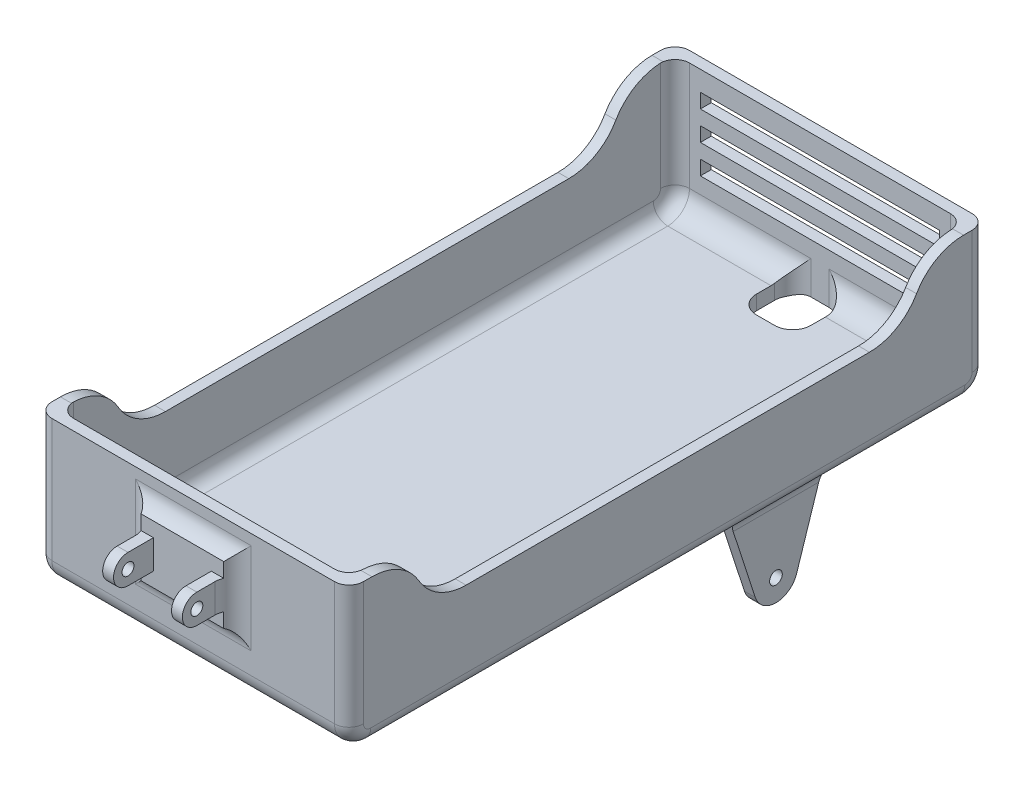
from build123d import *

# Parameters (mm, degrees)
SKETCH_1_W          = 22
SKETCH_1_H          = 16
EXTRUDE_1_DEPTH     = 3
SKETCH_2_R          = 1.65
EXTRUDE_2_DEPTH     = 3
SKETCH_3_W          = 176
SKETCH_3_H          = 40
EXTRUDE_3_DEPTH     = 43
SKETCH_4_W          = 80
SKETCH_4_H          = 170
CUT_EXTRUDE_1_DEPTH = 36
EXTRUDE_START       = -5
SKETCH_5_R          = 1.75
EXTRUDE_4_DEPTH     = 3
FILLET_1_R          = 5
CUT_EXTRUDE_2_DEPTH = 203.544439568
SKETCH_7_W          = 15
SKETCH_7_H          = 15
CUT_EXTRUDE_3_DEPTH = 185.718705063
FILLET_2_R          = 5
FILLET_3_R          = 6
FILLET_4_R          = 6
FILLET_5_R          = 6
FILLET_6_R          = 6
FILLET_7_R          = 4
FILLET_8_R          = 4
FILLET_START        = -44
FILLET_10_DEPTH     = 88
FILLET_START_2      = -43
FILLET_10_2_DEPTH   = 3
FILLET_START_3      = 40
FILLET_10_3_DEPTH   = 3
FILLET_11_R         = 5
FILLET_12_R         = 5
FILLET_13_R         = 5
CUT_EXTRUDE_5_REACH = 203.498
SKETCH_9_W          = 66
SKETCH_9_H          = 4


with BuildPart() as part:
    # 草图1 → 凸台-拉伸1 (new body)
    with BuildSketch(Plane.XY):
        Rectangle(SKETCH_1_W, SKETCH_1_H)
    extrude(amount=EXTRUDE_1_DEPTH)

    # 草图2 → 凸台-拉伸2 (add)
    with BuildSketch(Plane(origin=(11, 0, 0), x_dir=(0, 0, -1), z_dir=(1, 0, 0))):
        with BuildLine():
            Line((-3, -4), (-10, -4))
            ThreePointArc((-10, -4), (-14, 0), (-10, 4))
            Line((-10, 4), (-3, 4))
            Line((-3, 4), (-3, -4))
        make_face()
        with Locations((-10, 0)):
            Circle(SKETCH_2_R, mode=Mode.SUBTRACT)
    extrude_2 = extrude(amount=-EXTRUDE_2_DEPTH)

    # 镜向1: 凸台-拉伸2 across plane
    add(extrude_2.mirror(Plane(origin=(0, 0, 0), x_dir=(0, 0, 1), z_dir=(1, 0, 0))))

    # 草图3 → 凸台-拉伸3 (add, symmetric)
    with BuildSketch(Plane(origin=(0, 0, 0), x_dir=(0, 0, -1), z_dir=(1, 0, 0))):
        with Locations((88, -4.5)):
            Rectangle(SKETCH_3_W, SKETCH_3_H)
    extrude(amount=EXTRUDE_3_DEPTH, both=True)

    # 草图4 → 切除-拉伸1 (cut)
    with BuildSketch(Plane(origin=(0, 15.5, 0), x_dir=(1, 0, 0), z_dir=(0, 1, 0))):
        with Locations((0, 88)):
            Rectangle(SKETCH_4_W, SKETCH_4_H)
    extrude(amount=-CUT_EXTRUDE_1_DEPTH, mode=Mode.SUBTRACT)

    # 草图5 → 凸台-拉伸4 (add)
    with BuildSketch(Plane(origin=(43, 0, 0), x_dir=(0, 0, -1), z_dir=(1, 0, 0)).offset(EXTRUDE_START)):
        with BuildLine():
            Line((109.735826067, -24.5), (117.161573936, -47.354101966))
            ThreePointArc((117.161573936, -47.354101966), (122.867913034, -51.5), (128.574252131, -47.354101966))
            Line((128.574252131, -47.354101966), (136, -24.5))
            Line((136, -24.5), (109.735826067, -24.5))
        make_face()
        with Locations((122.867913034, -45.5)):
            Circle(SKETCH_5_R, mode=Mode.SUBTRACT)
    extrude_4 = extrude(amount=-EXTRUDE_4_DEPTH)

    # 镜向2: 凸台-拉伸4 across plane
    add(extrude_4.mirror(Plane(origin=(0, 0, 0), x_dir=(0, 0, 1), z_dir=(1, 0, 0))))

    # 圆角1
    fillet_1_edges = [part.edges().sort_by_distance(p)[0] for p in [
        (35, -24.5, -122.867913034),
        (-35, -24.5, -122.867913034),
    ]]
    fillet(fillet_1_edges, radius=FILLET_1_R)

    # 草图6 → 切除-拉伸2 (cut, through all)
    with BuildSketch(Plane(origin=(43, 0, 0), x_dir=(0, 0, -1), z_dir=(1, 0, 0))):
        Polygon((15, 15.5), (23.660254038, 0.5), (152.339745962, 0.5), (161, 15.5), align=None)
    extrude(amount=-CUT_EXTRUDE_2_DEPTH, mode=Mode.SUBTRACT)

    # 草图7 → 切除-拉伸3 (cut, through all)
    with BuildSketch(Plane(origin=(0, -20.5, 0), x_dir=(1, 0, 0), z_dir=(0, 1, 0))):
        with Locations((0, 165.5)):
            Rectangle(SKETCH_7_W, SKETCH_7_H)
    extrude(amount=-CUT_EXTRUDE_3_DEPTH, mode=Mode.SUBTRACT)

    # 圆角2
    fillet_2_edges = [part.edges().sort_by_distance(p)[0] for p in [
        (7.5, -22.5, -173),
        (7.5, -22.5, -158),
        (-7.5, -22.5, -158),
        (-7.5, -22.5, -173),
    ]]
    fillet(fillet_2_edges, radius=FILLET_2_R)

    # 圆角3
    fillet_3_edges = [part.edges().sort_by_distance(p)[0] for p in [
        (0, -24.5, 0),
    ]]
    fillet(fillet_3_edges, radius=FILLET_3_R)

    # 圆角4
    fillet_4_edges = [part.edges().sort_by_distance(p)[0] for p in [
        (0, -20.5, -3),
    ]]
    fillet(fillet_4_edges, radius=FILLET_4_R)

    # 圆角5
    fillet_5_edges = [part.edges().sort_by_distance(p)[0] for p in [
        (21.25, -20.5, -173),
        (-21.25, -20.5, -173),
    ]]
    fillet(fillet_5_edges, radius=FILLET_5_R)

    # 圆角6
    # the kernel refuses this fillet: 6 mm, written as the material it takes off along each edge
    with BuildSketch(Plane(origin=(58, -24.5, -176), x_dir=(0, 0, 1), z_dir=(-1, 0, 0))) as fillet_6_piece_1:
        with BuildLine():
            CenterArc((FILLET_6_R, FILLET_6_R), FILLET_6_R, 180, 90)
            Line((0, FILLET_6_R), (0, 0))
            Line((0, 0), (FILLET_6_R, 0))
        make_face()
    extrude(amount=116, mode=Mode.SUBTRACT)

    # 圆角7
    fillet_7_edges = [part.edges().sort_by_distance(p)[0] for p in [
        (-43, -24.5, -88),
        (43, -24.5, -88),
        (-43, -22.742640687, -1.757359313),
        (43, -22.742640687, -1.757359313),
        (-43, -1.5, -176),
        (43, -1.5, -176),
        (-43, -22.742640687, -174.242640687),
        (43, -22.742640687, -174.242640687),
        (-43, -1.5, 0),
        (43, -1.5, 0),
    ]]
    fillet(fillet_7_edges, radius=FILLET_7_R)

    # 圆角8
    fillet_8_edges = [part.edges().sort_by_distance(p)[0] for p in [
        (40, -20.5, -88),
        (40, 0.5, -3),
        (40, -18.742640687, -4.757359313),
        (-40, 0.5, -3),
        (-40, -18.742640687, -4.757359313),
        (-40, -20.5, -88),
        (40, 0.5, -173),
        (-40, 0.5, -173),
        (40, -18.742640687, -171.242640687),
        (-40, -18.742640687, -171.242640687),
    ]]
    fillet(fillet_8_edges, radius=FILLET_8_R)

    # 圆角10: read off the stored shape, not the designer's step
    # 圆角10 outline → 圆角10 (cut)
    with BuildSketch(Plane.YZ.offset(FILLET_START)):
        with BuildLine():
            Line((15.5, -161), (8, -156.669872981))
            ThreePointArc((8, -156.669872981), (13.490381057, -162.160254038), (15.5, -169.660254038))
            Line((15.5, -169.660254038), (15.5, -161))
        make_face()
        with BuildLine():
            ThreePointArc((15.5, -6.339745962), (13.490381057, -13.839745962), (8, -19.330127019))
            Line((8, -19.330127019), (15.5, -15))
            Line((15.5, -15), (15.5, -6.339745962))
        make_face()
    extrude(amount=FILLET_10_DEPTH, mode=Mode.SUBTRACT)

    # Fillet 10 2 outline → Fillet 10 2 (add)
    with BuildSketch(Plane.YZ.offset(FILLET_START_2)):
        with BuildLine():
            Line((0.5, -23.660254038), (0.5, -32.320508076))
            ThreePointArc((0.5, -32.320508076), (2.509618943, -24.820508076), (8, -19.330127019))
            Line((8, -19.330127019), (0.5, -23.660254038))
        make_face()
        with BuildLine():
            ThreePointArc((8, -156.669872981), (2.509618943, -151.179491924), (0.5, -143.679491924))
            Line((0.5, -143.679491924), (0.5, -152.339745962))
            Line((0.5, -152.339745962), (8, -156.669872981))
        make_face()
    extrude(amount=FILLET_10_2_DEPTH)

    # Fillet 10 3 outline → Fillet 10 3 (add)
    with BuildSketch(Plane.YZ.offset(FILLET_START_3)):
        with BuildLine():
            Line((0.5, -23.660254038), (0.5, -32.320508076))
            ThreePointArc((0.5, -32.320508076), (2.509618943, -24.820508076), (8, -19.330127019))
            Line((8, -19.330127019), (0.5, -23.660254038))
        make_face()
        with BuildLine():
            ThreePointArc((8, -156.669872981), (2.509618943, -151.179491924), (0.5, -143.679491924))
            Line((0.5, -143.679491924), (0.5, -152.339745962))
            Line((0.5, -152.339745962), (8, -156.669872981))
        make_face()
    extrude(amount=FILLET_10_3_DEPTH)

    # 圆角11
    # the kernel refuses this fillet: 5 mm, written as the material it adds along each edge
    with BuildSketch(Plane(origin=(-11, -8, 0), x_dir=(0, -1, 0), z_dir=(1, 0, 0)), Plane(origin=(11, 8, 0), x_dir=(0, 1, 0), z_dir=(-1, 0, 0))) as fillet_11_piece_1:
        with BuildLine():
            CenterArc((4.582575695, -5), FILLET_11_R, 90, 66.421821522)
            Line((0, -3), (0, 0))
            Line((0, 0), (4.582575695, 0))
        make_face()
    extrude(amount=22)
    with BuildSketch(Plane(origin=(-11, 8, 0), x_dir=(-1, 0, 0), z_dir=(0, -1, 0))) as fillet_11_piece_2_section:
        with BuildLine():
            CenterArc((FILLET_11_R, -FILLET_11_R), FILLET_11_R, 90, 90)
            Line((0, -FILLET_11_R), (0, 0))
            Line((0, 0), (FILLET_11_R, 0))
        make_face()
    fillet_11_piece_2 = extrude(amount=16, mode=Mode.PRIVATE)
    fillet_11_piece_2 = split(fillet_11_piece_2, bisect_by=Plane(origin=(-11, 8, 3), z_dir=(0, 0, -1)), keep=Keep.TOP, mode=Mode.PRIVATE)
    add(fillet_11_piece_2)
    with BuildSketch(Plane(origin=(-11, 20.5, 0), x_dir=(-1, 0, 0), z_dir=(0, -1, 0))) as fillet_11_piece_3_section:
        with BuildLine():
            CenterArc((FILLET_11_R, -FILLET_11_R), FILLET_11_R, 90, 90)
            Line((0, -FILLET_11_R), (0, 0))
            Line((0, 0), (FILLET_11_R, 0))
        make_face()
    fillet_11_piece_3 = extrude(amount=41, mode=Mode.PRIVATE)
    fillet_11_piece_3 = split(fillet_11_piece_3, bisect_by=Plane(origin=(-11, 4, 0), z_dir=(0, -1, 0)), keep=Keep.TOP, mode=Mode.PRIVATE)
    fillet_11_piece_3 = split(fillet_11_piece_3, bisect_by=Plane(origin=(-11, -4, 0), z_dir=(0, 1, 0)), keep=Keep.TOP, mode=Mode.PRIVATE)
    add(fillet_11_piece_3)
    with BuildSketch(Plane(origin=(11, -8, 0), x_dir=(1, 0, 0), z_dir=(0, 1, 0))) as fillet_11_piece_4_section:
        with BuildLine():
            CenterArc((FILLET_11_R, -FILLET_11_R), FILLET_11_R, 90, 90)
            Line((0, -FILLET_11_R), (0, 0))
            Line((0, 0), (FILLET_11_R, 0))
        make_face()
    fillet_11_piece_4 = extrude(amount=16, mode=Mode.PRIVATE)
    fillet_11_piece_4 = split(fillet_11_piece_4, bisect_by=Plane(origin=(11, -8, 3), z_dir=(0, 0, -1)), keep=Keep.TOP, mode=Mode.PRIVATE)
    add(fillet_11_piece_4)
    with BuildSketch(Plane(origin=(11, -20.5, 0), x_dir=(1, 0, 0), z_dir=(0, 1, 0))) as fillet_11_piece_5_section:
        with BuildLine():
            CenterArc((FILLET_11_R, -FILLET_11_R), FILLET_11_R, 90, 90)
            Line((0, -FILLET_11_R), (0, 0))
            Line((0, 0), (FILLET_11_R, 0))
        make_face()
    fillet_11_piece_5 = extrude(amount=41, mode=Mode.PRIVATE)
    fillet_11_piece_5 = split(fillet_11_piece_5, bisect_by=Plane(origin=(11, -4, 0), z_dir=(0, 1, 0)), keep=Keep.TOP, mode=Mode.PRIVATE)
    fillet_11_piece_5 = split(fillet_11_piece_5, bisect_by=Plane(origin=(11, 4, 0), z_dir=(0, -1, 0)), keep=Keep.TOP, mode=Mode.PRIVATE)
    add(fillet_11_piece_5)
    with BuildSketch(Plane(origin=(-11, 8, 0), x_dir=(-1, 0, 0), z_dir=(0, -1, 0))) as fillet_11_piece_6a_section:
        with BuildLine():
            CenterArc((FILLET_11_R, -FILLET_11_R), FILLET_11_R, 90, 90)
            Line((0, -FILLET_11_R), (0, 0))
            Line((0, 0), (FILLET_11_R, 0))
        make_face()
    fillet_11_piece_6a = extrude(amount=28.5, mode=Mode.PRIVATE)
    fillet_11_piece_6a = split(fillet_11_piece_6a, bisect_by=Plane(origin=(-11, -8, 0), z_dir=(0, -1, 0)), keep=Keep.TOP, mode=Mode.PRIVATE)
    fillet_11_piece_6a = split(fillet_11_piece_6a, bisect_by=Plane(origin=(-11, 8, 3), z_dir=(0, 0, -1)), keep=Keep.TOP, mode=Mode.PRIVATE)
    with BuildSketch(Plane(origin=(-22.456439237, -8, 0), x_dir=(0, -1, 0), z_dir=(1, 0, 0))) as fillet_11_piece_6b_section:
        with BuildLine():
            CenterArc((4.582575695, -5), FILLET_11_R, 90, 66.421821522)
            Line((0, -3), (0, 0))
            Line((0, 0), (4.582575695, 0))
        make_face()
    fillet_11_piece_6b = extrude(amount=33.456439237, mode=Mode.PRIVATE)
    fillet_11_piece_6b = split(fillet_11_piece_6b, bisect_by=Plane(origin=(-11, -8, 0), z_dir=(-1, 0, 0)), keep=Keep.TOP, mode=Mode.PRIVATE)
    fillet_11_piece_6 = fillet_11_piece_6a & fillet_11_piece_6b
    add(fillet_11_piece_6)
    with BuildSketch(Plane(origin=(11, -20.5, 0), x_dir=(1, 0, 0), z_dir=(0, 1, 0))) as fillet_11_piece_7a_section:
        with BuildLine():
            CenterArc((FILLET_11_R, -FILLET_11_R), FILLET_11_R, 90, 90)
            Line((0, -FILLET_11_R), (0, 0))
            Line((0, 0), (FILLET_11_R, 0))
        make_face()
    fillet_11_piece_7a = extrude(amount=28.5, mode=Mode.PRIVATE)
    fillet_11_piece_7a = split(fillet_11_piece_7a, bisect_by=Plane(origin=(11, -8, 0), z_dir=(0, -1, 0)), keep=Keep.TOP, mode=Mode.PRIVATE)
    fillet_11_piece_7a = split(fillet_11_piece_7a, bisect_by=Plane(origin=(11, -20.5, 3), z_dir=(0, 0, -1)), keep=Keep.TOP, mode=Mode.PRIVATE)
    with BuildSketch(Plane(origin=(-11, -8, 0), x_dir=(0, -1, 0), z_dir=(1, 0, 0))) as fillet_11_piece_7b_section:
        with BuildLine():
            CenterArc((4.582575695, -5), FILLET_11_R, 90, 66.421821522)
            Line((0, -3), (0, 0))
            Line((0, 0), (4.582575695, 0))
        make_face()
    fillet_11_piece_7b = extrude(amount=33.456439237, mode=Mode.PRIVATE)
    fillet_11_piece_7b = split(fillet_11_piece_7b, bisect_by=Plane(origin=(11, -8, 0), z_dir=(1, 0, 0)), keep=Keep.TOP, mode=Mode.PRIVATE)
    fillet_11_piece_7 = fillet_11_piece_7a & fillet_11_piece_7b
    add(fillet_11_piece_7)
    with BuildSketch(Plane(origin=(-11, 20.5, 0), x_dir=(-1, 0, 0), z_dir=(0, -1, 0))) as fillet_11_piece_8a_section:
        with BuildLine():
            CenterArc((FILLET_11_R, -FILLET_11_R), FILLET_11_R, 90, 90)
            Line((0, -FILLET_11_R), (0, 0))
            Line((0, 0), (FILLET_11_R, 0))
        make_face()
    fillet_11_piece_8a = extrude(amount=28.5, mode=Mode.PRIVATE)
    fillet_11_piece_8a = split(fillet_11_piece_8a, bisect_by=Plane(origin=(-11, 15.5, 0), z_dir=(0, -1, 0)), keep=Keep.TOP, mode=Mode.PRIVATE)
    fillet_11_piece_8a = split(fillet_11_piece_8a, bisect_by=Plane(origin=(-11, 8, 0), z_dir=(0, 1, 0)), keep=Keep.TOP, mode=Mode.PRIVATE)
    fillet_11_piece_8a = split(fillet_11_piece_8a, bisect_by=Plane(origin=(-11, 20.5, 3), z_dir=(0, 0, -1)), keep=Keep.TOP, mode=Mode.PRIVATE)
    with BuildSketch(Plane(origin=(11, 8, 0), x_dir=(0, 1, 0), z_dir=(-1, 0, 0))) as fillet_11_piece_8b_section:
        with BuildLine():
            CenterArc((4.582575695, -5), FILLET_11_R, 90, 66.421821522)
            Line((0, -3), (0, 0))
            Line((0, 0), (4.582575695, 0))
        make_face()
    fillet_11_piece_8b = extrude(amount=33.456439237, mode=Mode.PRIVATE)
    fillet_11_piece_8b = split(fillet_11_piece_8b, bisect_by=Plane(origin=(-11, 8, 0), z_dir=(-1, 0, 0)), keep=Keep.TOP, mode=Mode.PRIVATE)
    fillet_11_piece_8 = fillet_11_piece_8a & fillet_11_piece_8b
    add(fillet_11_piece_8)
    with BuildSketch(Plane(origin=(22.456439237, 8, 0), x_dir=(0, 1, 0), z_dir=(-1, 0, 0))) as fillet_11_piece_9a_section:
        with BuildLine():
            CenterArc((4.582575695, -5), FILLET_11_R, 90, 66.421821522)
            Line((0, -3), (0, 0))
            Line((0, 0), (4.582575695, 0))
        make_face()
    fillet_11_piece_9a = extrude(amount=33.456439237, mode=Mode.PRIVATE)
    fillet_11_piece_9a = split(fillet_11_piece_9a, bisect_by=Plane(origin=(11, 8, 0), z_dir=(1, 0, 0)), keep=Keep.TOP, mode=Mode.PRIVATE)
    with BuildSketch(Plane(origin=(11, -8, 0), x_dir=(1, 0, 0), z_dir=(0, 1, 0))) as fillet_11_piece_9b_section:
        with BuildLine():
            CenterArc((FILLET_11_R, -FILLET_11_R), FILLET_11_R, 90, 90)
            Line((0, -FILLET_11_R), (0, 0))
            Line((0, 0), (FILLET_11_R, 0))
        make_face()
    fillet_11_piece_9b = extrude(amount=28.5, mode=Mode.PRIVATE)
    fillet_11_piece_9b = split(fillet_11_piece_9b, bisect_by=Plane(origin=(11, 15.5, 0), z_dir=(0, -1, 0)), keep=Keep.TOP, mode=Mode.PRIVATE)
    fillet_11_piece_9b = split(fillet_11_piece_9b, bisect_by=Plane(origin=(11, 8, 0), z_dir=(0, 1, 0)), keep=Keep.TOP, mode=Mode.PRIVATE)
    fillet_11_piece_9b = split(fillet_11_piece_9b, bisect_by=Plane(origin=(11, -8, 3), z_dir=(0, 0, -1)), keep=Keep.TOP, mode=Mode.PRIVATE)
    fillet_11_piece_9 = fillet_11_piece_9a & fillet_11_piece_9b
    add(fillet_11_piece_9)

    # 圆角12
    # the kernel refuses this fillet: 5 mm, written as the material it adds along each edge
    with BuildSketch(Plane(origin=(-38, -24.5, -146.155644371), x_dir=(-0.9889307289952856, 0.14837794057356693, 0), z_dir=(0, 0, 1))) as fillet_12_piece_1_section:
        with BuildLine():
            CenterArc((4.341904206, 4.759181219), FILLET_12_R, 188.532937529, 63.612200039)
            Line((-0.602749439, 4.017291516), (-1.097214803, 3.943102546))
            Line((-1.097214803, 3.943102546), (-0.494465364, -0.07418897))
            Line((-0.494465364, -0.07418897), (0.07418897, -0.494465364))
            ThreePointArc((0.07418897, -0.494465364), (1.063119699, -0.346087424), (2.655566492, -0.475918122))
            Line((2.655566492, -0.475918122), (2.80886992, 0))
        make_face()
    fillet_12_piece_1 = extrude(amount=46.575462674, mode=Mode.PRIVATE)
    fillet_12_piece_1 = split(fillet_12_piece_1, bisect_by=Plane(origin=(-38, -21.515331006, -136.969777743), z_dir=(0, 0.3090169943749409, 0.9510565162951558)), keep=Keep.TOP, mode=Mode.PRIVATE)
    fillet_12_piece_1 = split(fillet_12_piece_1, bisect_by=Plane(origin=(-38, -35.203516045, -113.213609249), z_dir=(0, 0.3090169943749446, -0.9510565162951545)), keep=Keep.TOP, mode=Mode.PRIVATE)
    add(fillet_12_piece_1)

    # 圆角13
    # the kernel refuses this fillet: 5 mm, written as the material it adds along each edge
    with BuildSketch(Plane(origin=(38, -24.5, -146.155644371), x_dir=(0.9889307289952856, 0.14837794057356693, 0), z_dir=(0, 0, 1))) as fillet_13_piece_1_section:
        with BuildLine():
            CenterArc((4.341904206, -4.759181219), FILLET_13_R, 107.854862432, 63.612200039)
            Line((-0.602749439, -4.017291516), (-1.097214803, -3.943102546))
            Line((-1.097214803, -3.943102546), (-0.494465364, 0.07418897))
            Line((-0.494465364, 0.07418897), (0.07418897, 0.494465364))
            ThreePointArc((0.07418897, 0.494465364), (1.063119699, 0.346087424), (2.655566492, 0.475918122))
            Line((2.655566492, 0.475918122), (2.80886992, 0))
        make_face()
    fillet_13_piece_1 = extrude(amount=46.575462674, mode=Mode.PRIVATE)
    fillet_13_piece_1 = split(fillet_13_piece_1, bisect_by=Plane(origin=(38, -21.515331006, -136.969777743), z_dir=(0, 0.3090169943749409, 0.9510565162951558)), keep=Keep.TOP, mode=Mode.PRIVATE)
    fillet_13_piece_1 = split(fillet_13_piece_1, bisect_by=Plane(origin=(38, -35.203516045, -113.213609249), z_dir=(0, 0.3090169943749446, -0.9510565162951545)), keep=Keep.TOP, mode=Mode.PRIVATE)
    add(fillet_13_piece_1)

    # 草图9 → 切除-拉伸5 (cut, up to next)
    with BuildSketch(Plane(origin=(0, 0, -176), x_dir=(-1, 0, 0), z_dir=(0, 0, -1)), mode=Mode.PRIVATE) as cut_extrude_5_sk1:
        with Locations((0, 8)):
            Rectangle(SKETCH_9_W, SKETCH_9_H)
    cut_extrude_5_tool1 = extrude(cut_extrude_5_sk1.sketch, amount=-CUT_EXTRUDE_5_REACH, mode=Mode.PRIVATE) & part.part
    # 草图9 → 切除-拉伸5 (cut, up to next)
    with BuildSketch(Plane(origin=(0, 0, -176), x_dir=(-1, 0, 0), z_dir=(0, 0, -1)), mode=Mode.PRIVATE) as cut_extrude_5_sk2:
        Rectangle(SKETCH_9_W, SKETCH_9_H)
    cut_extrude_5_tool2 = extrude(cut_extrude_5_sk2.sketch, amount=-CUT_EXTRUDE_5_REACH, mode=Mode.PRIVATE) & part.part
    # 草图9 → 切除-拉伸5 (cut, up to next)
    with BuildSketch(Plane(origin=(0, 0, -176), x_dir=(-1, 0, 0), z_dir=(0, 0, -1)), mode=Mode.PRIVATE) as cut_extrude_5_sk3:
        with Locations((0, -8)):
            Rectangle(SKETCH_9_W, SKETCH_9_H)
    cut_extrude_5_tool3 = extrude(cut_extrude_5_sk3.sketch, amount=-CUT_EXTRUDE_5_REACH, mode=Mode.PRIVATE) & part.part
    add(cut_extrude_5_tool1.solids().sort_by_distance((0, 8, -176))[0], mode=Mode.SUBTRACT)
    add(cut_extrude_5_tool2.solids().sort_by_distance((0, 0, -176))[0], mode=Mode.SUBTRACT)
    add(cut_extrude_5_tool3.solids().sort_by_distance((0, -8, -176))[0], mode=Mode.SUBTRACT)


solid = part.part
